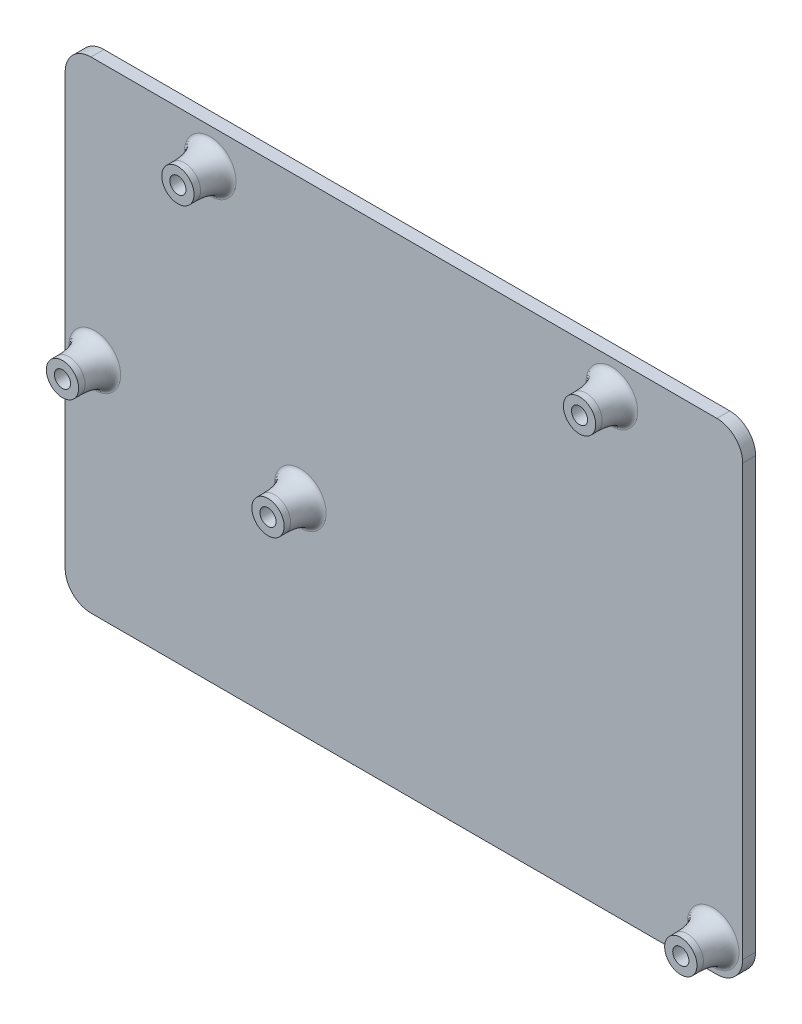
from build123d import *

# Parameters (mm, degrees)
SKETCH1_W           = 100.85
SKETCH1_H           = 70.53
BOSS_EXTRUDE1_DEPTH = 2
SKETCH6_W           = 104.85
SKETCH6_H           = 74.53
BOSS_EXTRUDE3_DEPTH = 2
SKETCH3_R           = 2.5
BOSS_EXTRUDE2_DEPTH = 5
FILLET1_SIZE        = 1.5
FILLET1_SIZE_2      = 4
FILLET2_R           = 4


with BuildPart() as part:
    # Sketch1 → Boss-Extrude1 (new body)
    with BuildSketch(Plane.XY):
        with Locations((0.782139599, -9.454393248)):
            Rectangle(SKETCH1_W, SKETCH1_H)
    extrude(amount=BOSS_EXTRUDE1_DEPTH)

    # Sketch6 → Boss-Extrude3 (add)
    with BuildSketch(Plane.XY.offset(2)):
        with Locations((0.782139599, -9.454393248)):
            Rectangle(SKETCH6_W, SKETCH6_H)
    extrude(amount=-BOSS_EXTRUDE3_DEPTH)

    # Sketch3 → Boss-Extrude2 (add)
    with BuildSketch(Plane.XY.offset(2)):
        with Locations((-29.192860401, 22.360606752)):
            Circle(SKETCH3_R)
    boss_extrude2 = extrude(amount=BOSS_EXTRUDE2_DEPTH)

    # Sketch5 → Tap Drill for M3x0.5 Tap1 (revolve, cut)
    with BuildSketch(Plane(origin=(-29.192860401, 22.360606752, 7), x_dir=(0, -1, 0), z_dir=(1, 0, 0))):
        Polygon((0, 0), (0, 10.751075774), (1.25, 10), (1.25, 0), align=None)
    tap_drill_for_m3x0_5_tap1 = revolve(axis=Axis((-29.192860401, 22.360606752, 13.35), (0, 0, -1)), mode=Mode.SUBTRACT)

    # Sketch-Pattern1: Boss-Extrude2, Tap Drill for M3x0.5 Tap1 at 4 more places
    with Locations((-17.86, -34.92, 0), (13.94, -37.51, 0), (77.82, -64.41, 0), (62.15, 0.23, 0)):
        add(boss_extrude2)
        add(tap_drill_for_m3x0_5_tap1, mode=Mode.SUBTRACT)

    # Fillet1
    # an asymmetric fillet: 4, 1.5 mm, written as the material it adds along each edge
    with BuildSketch(Plane(origin=(-29.192860401, 22.360606752, 2), x_dir=(1, 0, 0), z_dir=(0, -1, 0))) as fillet1_piece_1:
        with BuildLine():
            Bezier((2.5 + FILLET1_SIZE, 0), (2.5, 0), (2.5, FILLET1_SIZE_2), weights=[1, 0.707106781, 1])
            Line((2.5, FILLET1_SIZE_2), (2.5, 0))
            Line((2.5, 0), (2.5 + FILLET1_SIZE, 0))
        make_face()
    revolve(axis=Axis((-29.192860401, 22.360606752, 2), (0, 0, 1)))
    with BuildSketch(Plane(origin=(-47.052860401, -12.559393248, 2), x_dir=(1, 0, 0), z_dir=(0, -1, 0))) as fillet1_piece_2:
        with BuildLine():
            Bezier((2.5 + FILLET1_SIZE, 0), (2.5, 0), (2.5, FILLET1_SIZE_2), weights=[1, 0.707106781, 1])
            Line((2.5, FILLET1_SIZE_2), (2.5, 0))
            Line((2.5, 0), (2.5 + FILLET1_SIZE, 0))
        make_face()
    revolve(axis=Axis((-47.052860401, -12.559393248, 2), (0, 0, 1)))
    with BuildSketch(Plane(origin=(-15.252860401, -15.149393248, 2), x_dir=(1, 0, 0), z_dir=(0, -1, 0))) as fillet1_piece_3:
        with BuildLine():
            Bezier((2.5 + FILLET1_SIZE, 0), (2.5, 0), (2.5, FILLET1_SIZE_2), weights=[1, 0.707106781, 1])
            Line((2.5, FILLET1_SIZE_2), (2.5, 0))
            Line((2.5, 0), (2.5 + FILLET1_SIZE, 0))
        make_face()
    revolve(axis=Axis((-15.252860401, -15.149393248, 2), (0, 0, 1)))
    with BuildSketch(Plane(origin=(48.627139599, -42.049393248, 2), x_dir=(1, 0, 0), z_dir=(0, -1, 0))) as fillet1_piece_4:
        with BuildLine():
            Bezier((2.5 + FILLET1_SIZE, 0), (2.5, 0), (2.5, FILLET1_SIZE_2), weights=[1, 0.707106781, 1])
            Line((2.5, FILLET1_SIZE_2), (2.5, 0))
            Line((2.5, 0), (2.5 + FILLET1_SIZE, 0))
        make_face()
    revolve(axis=Axis((48.627139599, -42.049393248, 2), (0, 0, 1)))
    with BuildSketch(Plane(origin=(32.957139599, 22.590606752, 2), x_dir=(1, 0, 0), z_dir=(0, -1, 0))) as fillet1_piece_5:
        with BuildLine():
            Bezier((2.5 + FILLET1_SIZE, 0), (2.5, 0), (2.5, FILLET1_SIZE_2), weights=[1, 0.707106781, 1])
            Line((2.5, FILLET1_SIZE_2), (2.5, 0))
            Line((2.5, 0), (2.5 + FILLET1_SIZE, 0))
        make_face()
    revolve(axis=Axis((32.957139599, 22.590606752, 2), (0, 0, 1)))

    # Fillet2
    fillet2_edges = [part.edges().sort_by_distance(p)[0] for p in [
        (-51.642860401, 27.810606752, 1),
        (53.207139599, 27.810606752, 1),
        (53.207139599, -46.719393248, 1),
        (-51.642860401, -46.719393248, 1),
    ]]
    fillet(fillet2_edges, radius=FILLET2_R)


solid = part.part
